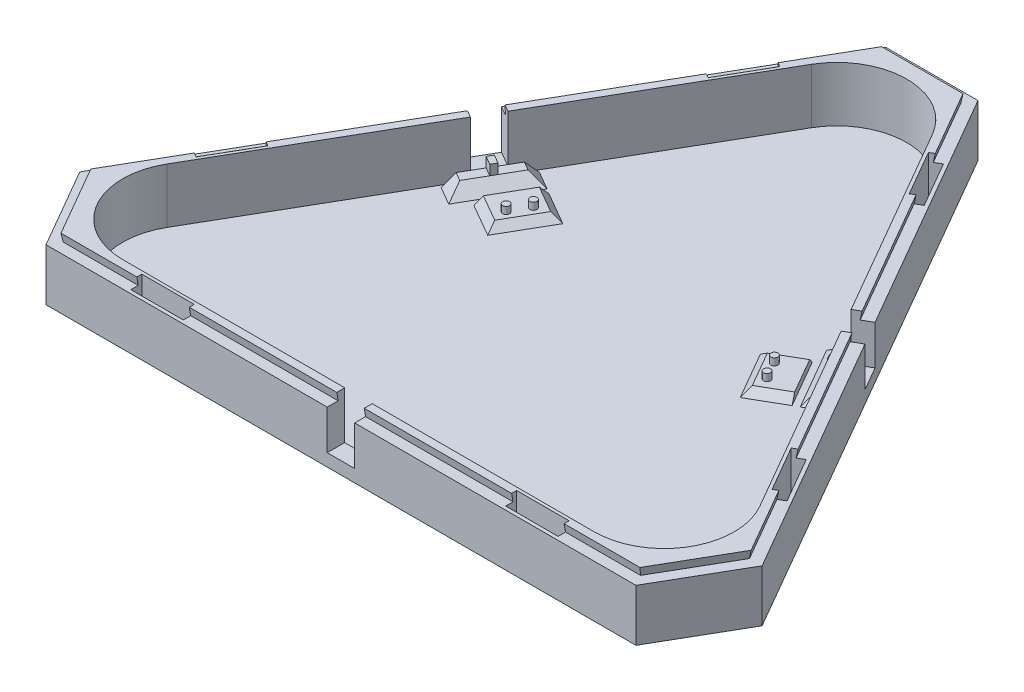
from build123d import *

# Parameters (mm, degrees)
BOSS_EXTRU_1_DEPTH                        = 12
ENL_V_MAT_EXTRU_1_DEPTH                   = 119.989845505
ENL_V_MAT_EXTRU_2_DEPTH                   = 11
ESQUISSE4_W                               = 5.5
ESQUISSE4_H                               = 3.5
ENL_V_MAT_EXTRU_3_DEPTH                   = 9.5
BOSS_EXTRU_2_DEPTH                        = 1.4
ESQUISSE13_R                              = 0.7
BOSS_EXTRU_3_DEPTH                        = 1.4
BOSS_EXTRU_6_DEPTH                        = 2.2
BOSS_EXTRU_7_DEPTH                        = 2
CHANFREIN3_SIZE                           = 2.2
CHANFREIN4_SIZE                           = 1.4
R_P_TITION_CIRCULAIRE2_COUNT              = 2
R_P_TITION_CIRCULAIRE2_ANGLE              = 120
CHANFREIN3_OF_R_P_TITION_CIRCULAIRE2_SIZE = 2.2
CHANFREIN4_OF_R_P_TITION_CIRCULAIRE2_SIZE = 1.4
ENL_V_DE_MAT_EXTRU_MINCE1_DEPTH           = 1.6
ENL_V_DE_MAT_EXTRU_MINCE1_DRAFT           = 10
ENL_V_DE_MAT_EXTRU_MINCE1_PROFILE_2_DEPTH = 1.6
ENL_V_DE_MAT_EXTRU_MINCE1_PROFILE_2_DRAFT = 10
ENL_V_DE_MAT_EXTRU_MINCE1_PROFILE_3_DEPTH = 1.6
ENL_V_DE_MAT_EXTRU_MINCE1_PROFILE_3_DRAFT = 10
ESQUISSE18_W                              = 10.5
ESQUISSE18_H                              = 2.2
ENL_V_MAT_EXTRU_10_DEPTH                  = 11


with BuildPart() as part:
    # Esquisse1 → Boss.-Extru.1 (new body)
    with BuildSketch(Plane(origin=(0, 0, 0), x_dir=(1, 0, 0), z_dir=(0, 1, 0))):
        Polygon((-77.5, -44.744645862), (77.5, -44.744645862), (0, 89.489291724), align=None)
    extrude(amount=BOSS_EXTRU_1_DEPTH)

    # Esquisse2 → Enlèv. mat.-Extru.1 (cut, through all)
    with BuildSketch(Plane(origin=(0, 12, 0), x_dir=(1, 0, 0), z_dir=(0, 1, 0))):
        Polygon((-9.237604307, 73.489291724), (9.237604307, 73.489291724), (0, 89.489291724), align=None)
        Polygon((77.5, -44.744645862), (68.262395693, -28.744645862), (59.024791386, -44.744645862), align=None)
        Polygon((-77.5, -44.744645862), (-59.024791386, -44.744645862), (-68.262395693, -28.744645862), align=None)
    extrude(amount=-ENL_V_MAT_EXTRU_1_DEPTH, mode=Mode.SUBTRACT)

    # Esquisse3 → Enlèv. mat.-Extru.2 (cut)
    with BuildSketch(Plane(origin=(0, 12, 0), x_dir=(1, 0, 0), z_dir=(0, 1, 0))):
        with BuildLine():
            Line((59.313466521, -20.244645862), (12.124355653, 61.489291724))
            ThreePointArc((12.124355653, 61.489291724), (0, 68.489291724), (-12.124355653, 61.489291724))
            Line((-12.124355653, 61.489291724), (-59.313466521, -20.244645862))
            ThreePointArc((-59.313466521, -20.244645862), (-59.313466521, -34.244645862), (-47.189110868, -41.244645862))
            Line((-47.189110868, -41.244645862), (47.189110868, -41.244645862))
            ThreePointArc((47.189110868, -41.244645862), (59.313466521, -34.244645862), (59.313466521, -20.244645862))
        make_face()
    extrude(amount=-ENL_V_MAT_EXTRU_2_DEPTH, mode=Mode.SUBTRACT)

    # Esquisse4 → Enlèv. mat.-Extru.3 (cut)
    with BuildSketch(Plane(origin=(0, 12, 0), x_dir=(1, 0, 0), z_dir=(0, 1, 0))):
        Polygon((37.093911087, 18.240753071), (34.343911087, 23.003892792), (37.375, 24.753892792), (40.125, 19.990753071), align=None)
        with Locations((0, -42.994645862)):
            Rectangle(ESQUISSE4_W, ESQUISSE4_H)
        Polygon((-37.375, 24.753892792), (-34.343911087, 23.003892792), (-37.093911087, 18.240753071), (-40.125, 19.990753071), align=None)
    extrude(amount=-ENL_V_MAT_EXTRU_3_DEPTH, mode=Mode.SUBTRACT)

    # Esquisse12 → Boss.-Extru.2 (add)
    with BuildSketch(Plane(origin=(0, 1, 0), x_dir=(1, 0, 0), z_dir=(0, 1, 0))):
        Polygon((23.928401161, 16.64408517), (28.028401161, 9.542676859), (33.397758664, 12.642676859), (29.297758664, 19.74408517), align=None)
    boss_extru_2 = extrude(amount=BOSS_EXTRU_2_DEPTH)

    # Esquisse13 → Boss.-Extru.3 (add)
    with BuildSketch(Plane(origin=(0, 2.4, 0), x_dir=(1, 0, 0), z_dir=(0, 1, 0))):
        with Locations(Location((26.364041807, 15.625431822, 0), (0, 0, 90))):
            Circle(ESQUISSE13_R)
        with Locations(Location((28.364041807, 12.161330207, 0), (0, 0, 90))):
            Circle(ESQUISSE13_R)
    boss_extru_3 = extrude(amount=BOSS_EXTRU_3_DEPTH)

    # Esquisse14 → Boss.-Extru.6 (add)
    with BuildSketch(Plane(origin=(0, 1, 0), x_dir=(1, 0, 0), z_dir=(0, 1, 0))):
        Polygon((32.699295844, 24.65244995), (37.699295844, 15.992195912), (35.967245037, 14.992195912), (30.967245037, 23.65244995), align=None)
    boss_extru_6 = extrude(amount=BOSS_EXTRU_6_DEPTH)

    # Esquisse15 → Boss.-Extru.7 (add)
    with BuildSketch(Plane(origin=(0, 3.2, 0), x_dir=(1, 0, 0), z_dir=(0, 1, 0))):
        Polygon((34.899295844, 20.841938173), (35.499295844, 19.802707689), (33.767245037, 18.802707689), (33.167245037, 19.841938173), align=None)
    boss_extru_7 = extrude(amount=BOSS_EXTRU_7_DEPTH)

    # Chanfrein3
    chanfrein3_edges = [part.edges().sort_by_distance(p)[0] for p in [
        (33.467245037, 1, -19.322322931),
        (36.833270441, 1, -15.492195912),
        (31.833270441, 1, -24.15244995),
    ]]
    chamfer(chanfrein3_edges, length=CHANFREIN3_SIZE - 0.0001)  # a hair under: the kernel refuses the full size

    # Chanfrein4
    chanfrein4_edges = [part.edges().sort_by_distance(p)[0] for p in [
        (26.613079912, 1, -18.19408517),
        (25.978401161, 1, -13.093381015),
        (30.713079912, 1, -11.092676859),
    ]]
    chamfer(chanfrein4_edges, length=CHANFREIN4_SIZE - 0.0001)  # a hair under: the kernel refuses the full size

    # Répétition circulaire2: Boss.-Extru.2, Boss.-Extru.3, Boss.-Extru.6, Boss.-Extru.7 ×2 about axis
    r_p_tition_circulaire2_axis = Axis((0, 0, 0), (0, 1, 0))
    add([boss_extru_2.rotate(r_p_tition_circulaire2_axis, i * R_P_TITION_CIRCULAIRE2_ANGLE / (R_P_TITION_CIRCULAIRE2_COUNT - 1)) for i in range(1, R_P_TITION_CIRCULAIRE2_COUNT)])
    add([boss_extru_3.rotate(r_p_tition_circulaire2_axis, i * R_P_TITION_CIRCULAIRE2_ANGLE / (R_P_TITION_CIRCULAIRE2_COUNT - 1)) for i in range(1, R_P_TITION_CIRCULAIRE2_COUNT)])
    add([boss_extru_6.rotate(r_p_tition_circulaire2_axis, i * R_P_TITION_CIRCULAIRE2_ANGLE / (R_P_TITION_CIRCULAIRE2_COUNT - 1)) for i in range(1, R_P_TITION_CIRCULAIRE2_COUNT)])
    add([boss_extru_7.rotate(r_p_tition_circulaire2_axis, i * R_P_TITION_CIRCULAIRE2_ANGLE / (R_P_TITION_CIRCULAIRE2_COUNT - 1)) for i in range(1, R_P_TITION_CIRCULAIRE2_COUNT)])

    # Chanfrein3 of Répétition circulaire2
    chanfrein3_of_r_p_tition_circulaire2_edges = [part.edges().sort_by_distance(p)[0] for p in [
        (-33.467245037, 1, -19.322322931),
        (-31.833270441, 1, -24.15244995),
        (-36.833270441, 1, -15.492195912),
    ]]
    chamfer(chanfrein3_of_r_p_tition_circulaire2_edges, length=CHANFREIN3_OF_R_P_TITION_CIRCULAIRE2_SIZE - 0.0001)  # a hair under: the kernel refuses the full size

    # Chanfrein4 of Répétition circulaire2
    chanfrein4_of_r_p_tition_circulaire2_edges = [part.edges().sort_by_distance(p)[0] for p in [
        (-29.063079912, 1, -13.950560692),
        (-24.328401161, 1, -15.951264847),
        (-24.963079912, 1, -21.051969003),
    ]]
    chamfer(chanfrein4_of_r_p_tition_circulaire2_edges, length=CHANFREIN4_OF_R_P_TITION_CIRCULAIRE2_SIZE - 0.0001)  # a hair under: the kernel refuses the full size


with BuildPart() as enl_v_de_mat_extru_mince1_tool:
    # Esquisse17 → Enlèv. de mat.-Extru.-Mince1 (with draft: the straight prism first)
    with BuildSketch(Plane(origin=(0, 12, 0), x_dir=(1, 0, 0), z_dir=(0, 1, 0))):
        Polygon((37.375, 24.753892792), (9.237604307, 73.489291724), (-9.237604307, 73.489291724), (-37.375, 24.753892792), (-35.729551733, 23.803892792), (-8.140638796, 71.589291724), (8.140638796, 71.589291724), (35.729551733, 23.803892792), align=None)
    extrude(amount=-ENL_V_DE_MAT_EXTRU_MINCE1_DEPTH)
    # Enlèv. de mat.-Extru.-Mince1: the draft: its side faces are tilted about the plane it starts from
    enl_v_de_mat_extru_mince1_sides = [enl_v_de_mat_extru_mince1_tool.faces().sort_by_distance(p)[0] for p in [
        (23.306302154, 11.2, -49.121592258),
        (0, 11.2, -73.489291724),
        (-23.306302154, 11.2, -49.121592258),
        (-36.552275866, 11.2, -24.278892792),
        (-21.935095264, 11.2, -47.696592258),
        (0, 11.2, -71.589291724),
        (21.935095264, 11.2, -47.696592258),
        (36.552275866, 11.2, -24.278892792),
    ]]
    draft(enl_v_de_mat_extru_mince1_sides, Plane(origin=(0, 12, 0), x_dir=(1, 0, 0), z_dir=(0, 1, 0)), ENL_V_DE_MAT_EXTRU_MINCE1_DRAFT)


with BuildPart() as part_1:
    add(part.part)

    # Enlèv. de mat.-Extru.-Mince1: cut by enl_v_de_mat_extru_mince1_tool
    add(enl_v_de_mat_extru_mince1_tool.part, mode=Mode.SUBTRACT)


with BuildPart() as enl_v_de_mat_extru_mince1_profile_2_tool:
    # Esquisse17 → Enlèv. de mat.-Extru.-Mince1 profile 2 (with draft: the straight prism first)
    with BuildSketch(Plane(origin=(0, 12, 0), x_dir=(1, 0, 0), z_dir=(0, 1, 0))):
        Polygon((-40.125, 19.990753071), (-68.262395693, -28.744645862), (-59.024791386, -44.744645862), (-2.75, -44.744645862), (-2.75, -42.844645862), (-57.927825874, -42.844645862), (-66.06846467, -28.744645862), (-38.479551733, 19.040753071), align=None)
    extrude(amount=-ENL_V_DE_MAT_EXTRU_MINCE1_PROFILE_2_DEPTH)
    # Enlèv. de mat.-Extru.-Mince1 profile 2: the draft: its side faces are tilted about the plane it starts from
    enl_v_de_mat_extru_mince1_profile_2_sides = [enl_v_de_mat_extru_mince1_profile_2_tool.faces().sort_by_distance(p)[0] for p in [
        (-54.193697846, 11.2, 4.376946396),
        (-63.643593539, 11.2, 36.744645862),
        (-30.887395693, 11.2, 44.744645862),
        (-2.75, 11.2, 43.794645862),
        (-30.338912937, 11.2, 42.844645862),
        (-61.998145272, 11.2, 35.794645862),
        (-52.274008201, 11.2, 4.851946396),
        (-39.302275866, 11.2, -19.515753071),
    ]]
    draft(enl_v_de_mat_extru_mince1_profile_2_sides, Plane(origin=(0, 12, 0), x_dir=(1, 0, 0), z_dir=(0, 1, 0)), ENL_V_DE_MAT_EXTRU_MINCE1_PROFILE_2_DRAFT)


with BuildPart() as part_2:
    add(part_1.part)

    # Enlèv. de mat.-Extru.-Mince1 profile 2: cut by enl_v_de_mat_extru_mince1_profile_2_tool
    add(enl_v_de_mat_extru_mince1_profile_2_tool.part, mode=Mode.SUBTRACT)


with BuildPart() as enl_v_de_mat_extru_mince1_profile_3_tool:
    # Esquisse17 → Enlèv. de mat.-Extru.-Mince1 profile 3 (with draft: the straight prism first)
    with BuildSketch(Plane(origin=(0, 12, 0), x_dir=(1, 0, 0), z_dir=(0, 1, 0))):
        Polygon((2.75, -44.744645862), (59.024791386, -44.744645862), (68.262395693, -28.744645862), (40.125, 19.990753071), (38.479551733, 19.040753071), (66.06846467, -28.744645862), (57.927825874, -42.844645862), (2.75, -42.844645862), align=None)
    extrude(amount=-ENL_V_DE_MAT_EXTRU_MINCE1_PROFILE_3_DEPTH)
    # Enlèv. de mat.-Extru.-Mince1 profile 3: the draft: its side faces are tilted about the plane it starts from
    enl_v_de_mat_extru_mince1_profile_3_sides = [enl_v_de_mat_extru_mince1_profile_3_tool.faces().sort_by_distance(p)[0] for p in [
        (30.887395693, 11.2, 44.744645862),
        (63.643593539, 11.2, 36.744645862),
        (54.193697846, 11.2, 4.376946396),
        (39.302275866, 11.2, -19.515753071),
        (52.274008201, 11.2, 4.851946396),
        (61.998145272, 11.2, 35.794645862),
        (30.338912937, 11.2, 42.844645862),
        (2.75, 11.2, 43.794645862),
    ]]
    draft(enl_v_de_mat_extru_mince1_profile_3_sides, Plane(origin=(0, 12, 0), x_dir=(1, 0, 0), z_dir=(0, 1, 0)), ENL_V_DE_MAT_EXTRU_MINCE1_PROFILE_3_DRAFT)


with BuildPart() as part_3:
    add(part_2.part)

    # Enlèv. de mat.-Extru.-Mince1 profile 3: cut by enl_v_de_mat_extru_mince1_profile_3_tool
    add(enl_v_de_mat_extru_mince1_profile_3_tool.part, mode=Mode.SUBTRACT)

    # Esquisse18 → Enlèv. mat.-Extru.10 (cut)
    with BuildSketch(Plane(origin=(0, 12, 0), x_dir=(1, 0, 0), z_dir=(0, 1, 0))):
        with Locations((37.5, -42.944645862)):
            Rectangle(ESQUISSE18_W, ESQUISSE18_H)
        with Locations((-37.5, -42.944645862)):
            Rectangle(ESQUISSE18_W, ESQUISSE18_H)
        Polygon((-52.363526329, -7.006996341), (-57.613526329, -16.100263081), (-59.518782217, -15.000263081), (-54.268782217, -5.906996341), align=None)
        Polygon((-20.113526329, 48.851642203), (-22.018782217, 49.951642203), (-16.768782217, 59.044908943), (-14.863526329, 57.944908943), align=None)
        Polygon((20.113526329, 48.851642203), (14.863526329, 57.944908943), (16.768782217, 59.044908943), (22.018782217, 49.951642203), align=None)
        Polygon((52.363526329, -7.006996341), (54.268782217, -5.906996341), (59.518782217, -15.000263081), (57.613526329, -16.100263081), align=None)
    extrude(amount=-ENL_V_MAT_EXTRU_10_DEPTH, mode=Mode.SUBTRACT)


solid = part_3.part
